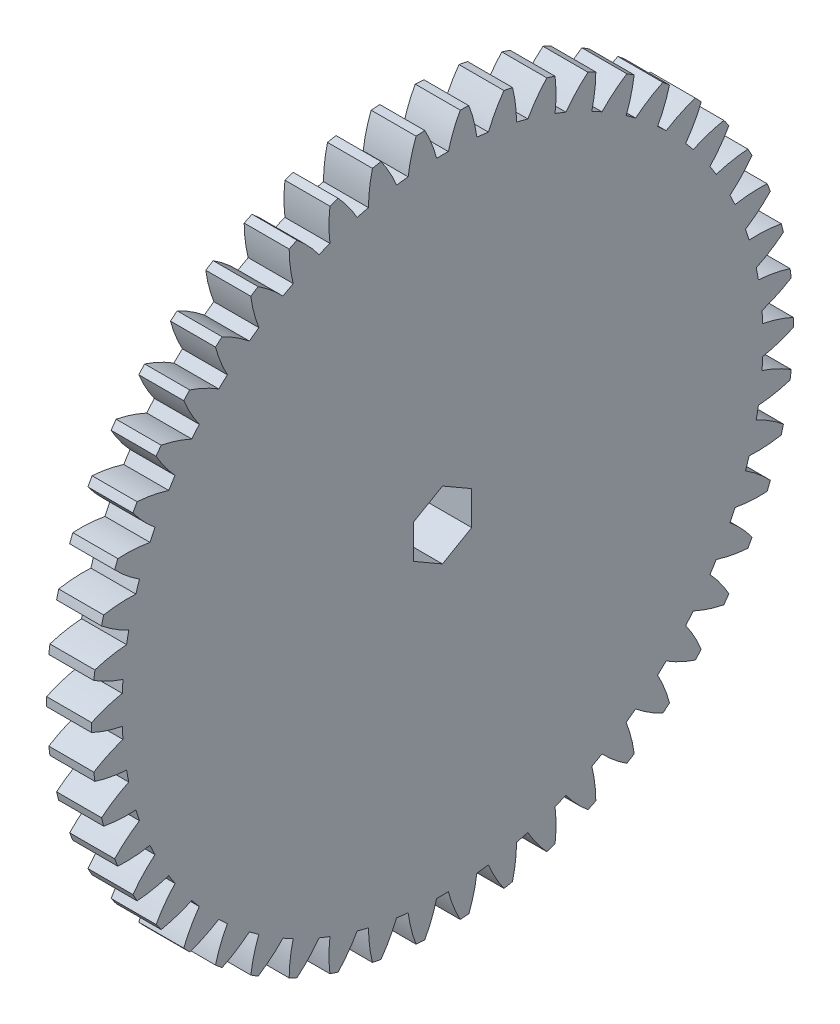
from build123d import *

# Parameters (mm, degrees)
BASPROSKE_W         = 5
BASPROSKE_H         = 39
TOOTHCUT_DEPTH      = 56.380501984
TEETHCUTS_COUNT     = 50
TEETHCUTS_ANGLE     = 352.8
BORE_DEPTH          = 50.0000508
BOSS_EXTRUDE1_DEPTH = 10


with BuildPart() as part:
    # BasProSke → Base-Revolve (revolve)
    with BuildSketch(Plane(origin=(0, 0, 0), x_dir=(1, 0, 0), z_dir=(0, 1, 0))):
        with Locations((2.5, 19.5)):
            Rectangle(BASPROSKE_W, BASPROSKE_H)
    revolve(axis=Axis((-10, 0, 0), (1, 0, 0)))

    # TooCutSke → ToothCut (cut, through all)
    with BuildSketch(Plane(origin=(0, 0, 0), x_dir=(0, 0, -1), z_dir=(1, 0, 0))):
        with BuildLine():
            ThreePointArc((0.649974317, 35.618069984), (0, 35.624), (-0.649974317, 35.618069984))
            ThreePointArc((-0.649974317, 35.618069984), (-1.213667282, 37.336773563), (-1.980135572, 38.975131921))
            ThreePointArc((-1.980135572, 38.975131921), (0, 39.0254), (1.980135572, 38.975131921))
            ThreePointArc((1.980135572, 38.975131921), (1.213667282, 37.336773563), (0.649974317, 35.618069984))
        make_face()
    toothcut = extrude(amount=TOOTHCUT_DEPTH, mode=Mode.SUBTRACT)

    # TeethCuts: ToothCut ×50 about axis
    teethcuts_axis = Axis((-10, 0, 0), (1, 0, 0))
    for i in range(1, TEETHCUTS_COUNT):
        add(toothcut.rotate(teethcuts_axis, i * TEETHCUTS_ANGLE / (TEETHCUTS_COUNT - 1)), mode=Mode.SUBTRACT)

    # BorSke → Bore (cut, symmetric)
    with BuildSketch(Plane(origin=(0, 0, 0), x_dir=(0, 0, -1), z_dir=(1, 0, 0))):
        Polygon((0, -3.75), (3.247595264, -1.875), (3.247595264, 1.875), (0, 3.75), (-3.247595264, 1.875), (-3.247595264, -1.875), align=None)
    extrude(amount=BORE_DEPTH, both=True, mode=Mode.SUBTRACT)

    # Sketch1 → Boss-Extrude1 (add)
    with BuildSketch(Plane.ZY):
        with BuildLine():
            ThreePointArc((0.186825145, -8.9980607), (1.087459567, -7.388027907), (0.875696034, -5.555405697))
            ThreePointArc((0.875696034, -5.555405697), (1.737911579, -5.348741847), (2.556932571, -5.009138831))
            ThreePointArc((2.556932571, -5.009138831), (3.462800583, -6.616232824), (5.137782668, -7.389397083))
            ThreePointArc((5.137782668, -7.389397083), (5.290067274, -7.281152947), (5.440072096, -7.169770958))
            ThreePointArc((5.440072096, -7.169770958), (5.222347117, -5.337847436), (3.973838512, -3.979696405))
            ThreePointArc((3.973838512, -3.979696405), (4.549911578, -3.305704257), (5.012899835, -2.549551185))
            ThreePointArc((5.012899835, -2.549551185), (6.690388599, -3.317261679), (8.499932121, -2.958234937))
            ThreePointArc((8.499932121, -2.958234937), (8.559508648, -2.781152945), (8.615396408, -2.602872401))
            ThreePointArc((8.615396408, -2.602872401), (7.36247557, -1.248790671), (5.554109745, -0.883878352))
            ThreePointArc((5.554109745, -0.883878352), (5.624, 3e-09), (5.554109744, 0.883878357))
            ThreePointArc((5.554109744, 0.883878357), (7.362475569, 1.248790678), (8.615396405, 2.602872409))
            ThreePointArc((8.615396405, 2.602872409), (8.559508645, 2.781152953), (8.499932118, 2.958234945))
            ThreePointArc((8.499932118, 2.958234945), (6.690388596, 3.317261685), (5.012899832, 2.54955119))
            ThreePointArc((5.012899832, 2.54955119), (4.549911575, 3.305704261), (3.973838508, 3.979696409))
            ThreePointArc((3.973838508, 3.979696409), (5.222347112, 5.33784744), (5.44007209, 7.169770963))
            ThreePointArc((5.44007209, 7.169770963), (5.290067267, 7.281152952), (5.137782661, 7.389397088))
            ThreePointArc((5.137782661, 7.389397088), (3.462800577, 6.616232827), (2.556932566, 5.009138833))
            ThreePointArc((2.556932566, 5.009138833), (1.737911574, 5.348741848), (0.875696028, 5.555405698))
            ThreePointArc((0.875696028, 5.555405698), (1.08745956, 7.388027908), (0.186825137, 8.9980607))
            ThreePointArc((0.186825137, 8.9980607), (-4e-09, 9), (-0.186825145, 8.9980607))
            ThreePointArc((-0.186825145, 8.9980607), (-1.087459567, 7.388027907), (-0.875696034, 5.555405697))
            ThreePointArc((-0.875696034, 5.555405697), (-1.737911579, 5.348741847), (-2.556932571, 5.009138831))
            ThreePointArc((-2.556932571, 5.009138831), (-3.462800583, 6.616232824), (-5.137782668, 7.389397083))
            ThreePointArc((-5.137782668, 7.389397083), (-5.290067274, 7.281152947), (-5.440072096, 7.169770958))
            ThreePointArc((-5.440072096, 7.169770958), (-5.222347117, 5.337847436), (-3.973838512, 3.979696405))
            ThreePointArc((-3.973838512, 3.979696405), (-4.549911578, 3.305704257), (-5.012899835, 2.549551185))
            ThreePointArc((-5.012899835, 2.549551185), (-6.690388599, 3.317261679), (-8.499932121, 2.958234937))
            ThreePointArc((-8.499932121, 2.958234937), (-8.559508648, 2.781152945), (-8.615396408, 2.602872401))
            ThreePointArc((-8.615396408, 2.602872401), (-7.36247557, 1.248790671), (-5.554109745, 0.883878352))
            ThreePointArc((-5.554109745, 0.883878352), (-5.624, -3e-09), (-5.554109744, -0.883878357))
            ThreePointArc((-5.554109744, -0.883878357), (-7.362475569, -1.248790678), (-8.615396405, -2.602872409))
            ThreePointArc((-8.615396405, -2.602872409), (-8.559508645, -2.781152953), (-8.499932118, -2.958234945))
            ThreePointArc((-8.499932118, -2.958234945), (-6.690388596, -3.317261685), (-5.012899832, -2.54955119))
            ThreePointArc((-5.012899832, -2.54955119), (-4.549911575, -3.305704261), (-3.973838508, -3.979696409))
            ThreePointArc((-3.973838508, -3.979696409), (-5.222347112, -5.33784744), (-5.44007209, -7.169770963))
            ThreePointArc((-5.44007209, -7.169770963), (-5.290067267, -7.281152952), (-5.137782661, -7.389397088))
            ThreePointArc((-5.137782661, -7.389397088), (-3.462800577, -6.616232827), (-2.556932566, -5.009138833))
            ThreePointArc((-2.556932566, -5.009138833), (-1.737911574, -5.348741848), (-0.875696028, -5.555405698))
            ThreePointArc((-0.875696028, -5.555405698), (-1.08745956, -7.388027908), (-0.186825137, -8.9980607))
            ThreePointArc((-0.186825137, -8.9980607), (4e-09, -9), (0.186825145, -8.9980607))
        make_face()
        Polygon((3.247595264, -1.875), (3.247595264, 1.875), (0, 3.75), (-3.247595264, 1.875), (-3.247595264, -1.875), (0, -3.75), align=None, mode=Mode.SUBTRACT)
    extrude(amount=BOSS_EXTRUDE1_DEPTH)


solid = part.part
